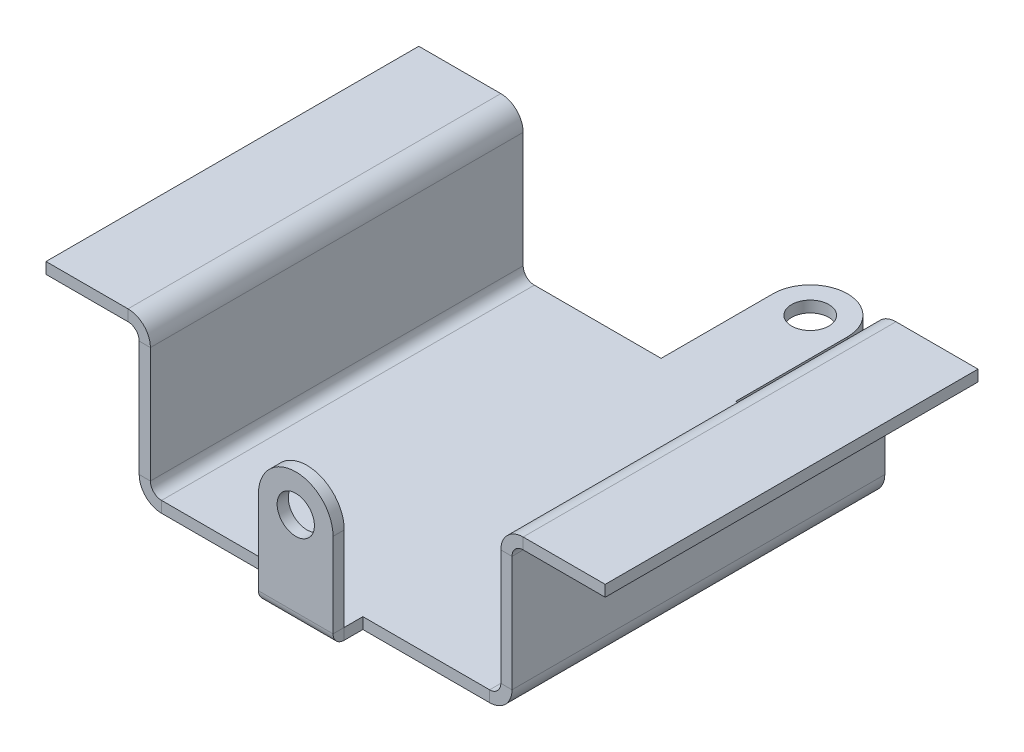
from build123d import *

# Parameters (mm, degrees)
SKETCH1_R                      = 5
BASE_FLANGE1_DEPTH             = 3
EDGE_FLANGE1_STRIP_W           = 18
EDGE_FLANGE1_STRIP_H           = 3
EDGE_FLANGE1_STRIP_CUT_DEPTH   = 100
EDGE_FLANGE1_STRIP_2_W         = 18
EDGE_FLANGE1_STRIP_2_H         = 3
EDGE_FLANGE1_STRIP_CUT_2_DEPTH = 100
EDGE_FLANGE1_DEPTH             = 100
EDGE_FLANGE1_BEND_DEPTH        = 100
EDGE_FLANGE2_STRIP_W           = 18
EDGE_FLANGE2_STRIP_H           = 3
EDGE_FLANGE2_STRIP_CUT_DEPTH   = 100
EDGE_FLANGE2_STRIP_2_W         = 18
EDGE_FLANGE2_STRIP_2_H         = 3
EDGE_FLANGE2_STRIP_CUT_2_DEPTH = 100
EDGE_FLANGE2_DEPTH             = 100
EDGE_FLANGE2_BEND_DEPTH        = 100
SKETCHED_START                 = 58
SKETCHED_BEND1_OUTLINE_W       = 20
SKETCHED_BEND1_OUTLINE_H       = 3
SKETCHED_BEND1_DEPTH           = 33
SKETCHED_START_2               = 55
SKETCHED_BEND1_2_OUTLINE_R     = 5
SKETCHED_BEND1_2_DEPTH         = 3
SKETCHED_START_3               = -11
SKETCHED_BEND1_3_DEPTH         = 22


with BuildPart() as part:
    # Base-Flange1: sheet metal written as solids
    # Sketch1 → Base-Flange1 (new body)
    with BuildSketch(Plane(origin=(0, 0, 0), x_dir=(1, 0, 0), z_dir=(0, 1, 0))):
        with BuildLine():
            Line((10, 50), (10, 80))
            ThreePointArc((10, 80), (0, 90), (-10, 80))
            Line((-10, 80), (-10, 50))
            Line((-10, 50), (-50, 50))
            Line((-50, 50), (-50, -50))
            Line((-50, -50), (-10, -50))
            Line((-10, -50), (-10, -80))
            ThreePointArc((-10, -80), (0, -90), (10, -80))
            Line((10, -80), (10, -50))
            Line((10, -50), (50, -50))
            Line((50, -50), (50, 50))
            Line((50, 50), (10, 50))
        make_face()
        with Locations(Location((0, 80, 0), (0, 0, 270))):
            Circle(SKETCH1_R, mode=Mode.SUBTRACT)
        with Locations(Location((0, -80, 0), (0, 0, 90))):
            Circle(SKETCH1_R, mode=Mode.SUBTRACT)
    extrude(amount=-BASE_FLANGE1_DEPTH)

    # Edge-Flange1: sheet metal written as solids
    # Edge-Flange1 strip (on a plane across the edge) → Edge-Flange1 strip cut (cut)
    with BuildSketch(Plane(origin=(50, 0, 50), x_dir=(-1, 0, 0), z_dir=(0, 0, -1))):
        with Locations((-3, -1.5)):
            Rectangle(EDGE_FLANGE1_STRIP_W, EDGE_FLANGE1_STRIP_H)
    extrude(amount=EDGE_FLANGE1_STRIP_CUT_DEPTH, mode=Mode.SUBTRACT)

    # Edge-Flange1 strip 2 (on a plane across the edge) → Edge-Flange1 strip cut 2 (cut)
    with BuildSketch(Plane(origin=(-50, 0, -50), x_dir=(1, 0, 0), z_dir=(0, 0, 1))):
        with Locations((-3, -1.5)):
            Rectangle(EDGE_FLANGE1_STRIP_2_W, EDGE_FLANGE1_STRIP_2_H)
    extrude(amount=EDGE_FLANGE1_STRIP_CUT_2_DEPTH, mode=Mode.SUBTRACT)

    # Edge-Flange1 section (on a plane across the edge) → Edge-Flange1 (add)
    with BuildSketch(Plane(origin=(50, 0, 50), x_dir=(-1, 0, 0), z_dir=(0, 0, -1))):
        with BuildLine():
            Line((0, 3), (0, 37))
            Line((0, 37), (3, 37))
            Line((3, 37), (3, 3))
            ThreePointArc((3, 3), (3.878679656, 0.878679656), (6, 0))
            Line((6, 0), (6, -3))
            ThreePointArc((6, -3), (1.757359313, -1.242640687), (0, 3))
        make_face()
    extrude(amount=EDGE_FLANGE1_DEPTH)

    # Edge-Flange1 section 2 (on a plane across the edge) → Edge-Flange1 bend (add)
    with BuildSketch(Plane(origin=(-50, 0, -50), x_dir=(1, 0, 0), z_dir=(0, 0, 1))):
        with BuildLine():
            Line((0, 3), (0, 37))
            Line((0, 37), (3, 37))
            Line((3, 37), (3, 3))
            ThreePointArc((3, 3), (3.878679656, 0.878679656), (6, 0))
            Line((6, 0), (6, -3))
            ThreePointArc((6, -3), (1.757359313, -1.242640687), (0, 3))
        make_face()
    extrude(amount=EDGE_FLANGE1_BEND_DEPTH)

    # Edge-Flange2: sheet metal written as solids
    # Edge-Flange2 strip (on a plane across the edge) → Edge-Flange2 strip cut (cut)
    with BuildSketch(Plane(origin=(-50, 37, 50), x_dir=(0, -1, 0), z_dir=(0, 0, -1))):
        with Locations((-6, -1.5)):
            Rectangle(EDGE_FLANGE2_STRIP_W, EDGE_FLANGE2_STRIP_H)
    extrude(amount=EDGE_FLANGE2_STRIP_CUT_DEPTH, mode=Mode.SUBTRACT)

    # Edge-Flange2 strip 2 (on a plane across the edge) → Edge-Flange2 strip cut 2 (cut)
    with BuildSketch(Plane(origin=(50, 37, -50), x_dir=(0, -1, 0), z_dir=(0, 0, 1))):
        with Locations((-6, -1.5)):
            Rectangle(EDGE_FLANGE2_STRIP_2_W, EDGE_FLANGE2_STRIP_2_H)
    extrude(amount=EDGE_FLANGE2_STRIP_CUT_2_DEPTH, mode=Mode.SUBTRACT)

    # Edge-Flange2 section (on a plane across the edge) → Edge-Flange2 (add)
    with BuildSketch(Plane(origin=(-50, 37, 50), x_dir=(0, -1, 0), z_dir=(0, 0, -1))):
        with BuildLine():
            Line((-3, 3), (-3, 25))
            Line((-3, 25), (0, 25))
            Line((0, 25), (0, 3))
            ThreePointArc((0, 3), (0.878679656, 0.878679656), (3, 0))
            Line((3, 0), (3, -3))
            ThreePointArc((3, -3), (-1.242640687, -1.242640687), (-3, 3))
        make_face()
    extrude(amount=EDGE_FLANGE2_DEPTH)

    # Edge-Flange2 section 2 (on a plane across the edge) → Edge-Flange2 bend (add)
    with BuildSketch(Plane(origin=(50, 37, -50), x_dir=(0, -1, 0), z_dir=(0, 0, 1))):
        with BuildLine():
            Line((-3, 3), (-3, 25))
            Line((-3, 25), (0, 25))
            Line((0, 25), (0, 3))
            ThreePointArc((0, 3), (0.878679656, 0.878679656), (3, 0))
            Line((3, 0), (3, -3))
            ThreePointArc((3, -3), (-1.242640687, -1.242640687), (-3, 3))
        make_face()
    extrude(amount=EDGE_FLANGE2_BEND_DEPTH)

    # Sketched Bend1: read off the stored shape, not the designer's step
    # Sketched Bend1 outline → Sketched Bend1 (cut)
    with BuildSketch(Plane.XY.offset(SKETCHED_START)):
        with Locations((0, -1.5)):
            Rectangle(SKETCHED_BEND1_OUTLINE_W, SKETCHED_BEND1_OUTLINE_H)
    extrude(amount=SKETCHED_BEND1_DEPTH, mode=Mode.SUBTRACT)

    # Sketched Bend1 2 outline → Sketched Bend1 2 (add)
    with BuildSketch(Plane.XY.offset(SKETCHED_START_2)):
        with BuildLine():
            ThreePointArc((10, 22.64380551), (0, 32.64380551), (-10, 22.64380551))
            Line((-10, 22.64380551), (-10, 0))
            Line((-10, 0), (10, 0))
            Line((10, 0), (10, 22.64380551))
        make_face()
        with Locations((0, 22.64380551)):
            Circle(SKETCHED_BEND1_2_OUTLINE_R, mode=Mode.SUBTRACT)
    extrude(amount=SKETCHED_BEND1_2_DEPTH)

    # Sketched Bend1 3 outline → Sketched Bend1 3 (cut)
    with BuildSketch(Plane.YZ.offset(SKETCHED_START_3)):
        with BuildLine():
            ThreePointArc((-3, 55), (-2.121320344, 57.121320344), (0, 58))
            Line((0, 58), (-3, 58))
            Line((-3, 58), (-3, 55))
        make_face()
    extrude(amount=SKETCHED_BEND1_3_DEPTH, mode=Mode.SUBTRACT)


solid = part.part
